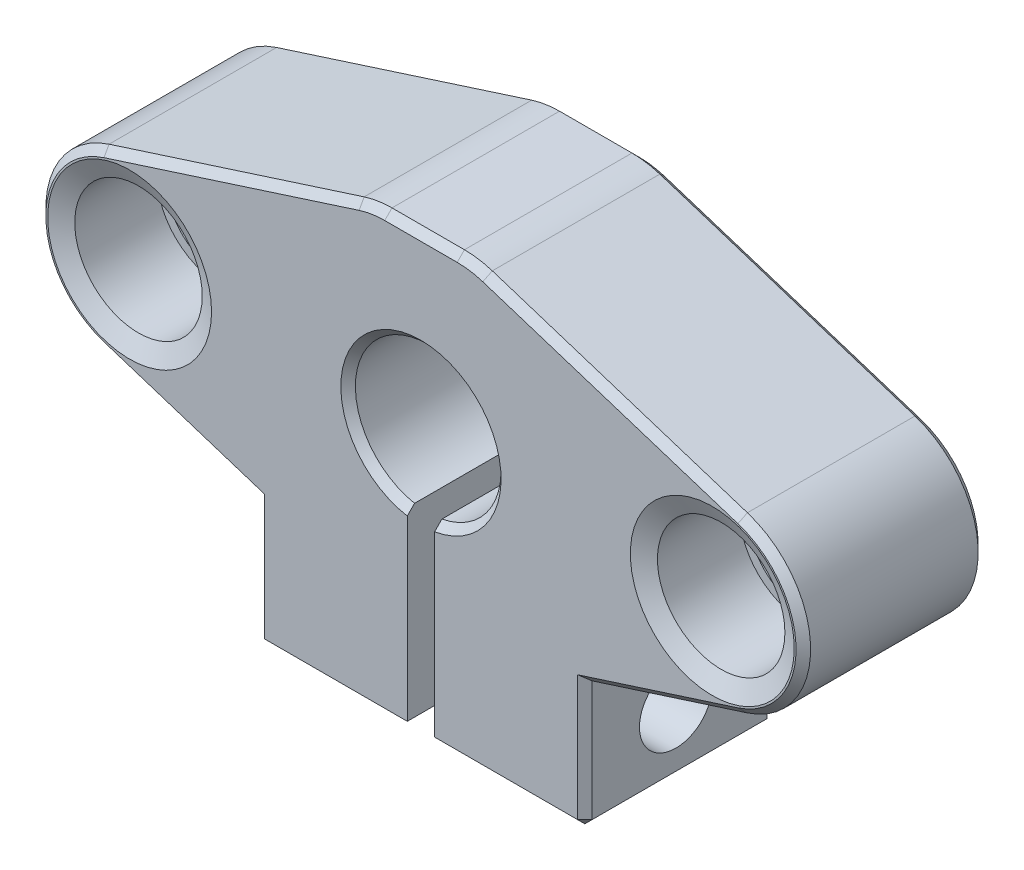
from build123d import *

# Parameters (mm, degrees)
BOSS_EXTRUDE1_DEPTH             = 10
CUT_EXTRUDE1_DEPTH              = 28.408940147
CUT_EXTRUDE2_DEPTH              = 28.408940147
SKETCH4_W                       = 4
SKETCH4_H                       = 10
SKETCH5_W                       = 2
SKETCH5_H                       = 20.25
F_4_0_4_DIAMETER_HOLE2_D        = 4
F_4_0_4_DIAMETER_HOLE2_DEPTH    = 20.25
M7X1_0_TAPPED_HOLE1_D           = 6
M7X1_0_TAPPED_HOLE1_CBORE_D     = 7
M7X1_0_TAPPED_HOLE1_CBORE_DEPTH = 5
FILLET1_R                       = 5
CHAMFER1_SIZE                   = 1
CHAMFER1_SIZE2                  = 0.487732589
CHAMFER2_SIZE                   = 0.4
CHAMFER3_SIZE                   = 1
CHAMFER3_SIZE2                  = 0.487732589


with BuildPart() as part:
    # Sketch1 → Boss-Extrude1 (new body)
    with BuildSketch(Plane.XY.offset(10)):
        with BuildLine():
            Line((-9, -7.5), (-9, -14.5))
            Line((-9, -14.5), (9, -14.5))
            Line((9, -14.5), (9, -7.5))
            Line((9, -7.5), (17.529062862, -4.760458672))
            ThreePointArc((17.529062862, -4.760458672), (21, 0), (17.529062862, 4.760458672))
            Line((17.529062862, 4.760458672), (2.773364341, 9.5))
            Line((2.773364341, 9.5), (-2.773364341, 9.5))
            Line((-2.773364341, 9.5), (-17.529062862, 4.760458672))
            ThreePointArc((-17.529062862, 4.760458672), (-21, 0), (-17.529062862, -4.760458672))
            Line((-17.529062862, -4.760458672), (-9, -7.5))
        make_face()
    extrude(amount=-BOSS_EXTRUDE1_DEPTH)

    # Sketch2 → Cut-Extrude1 (cut, through all)
    with BuildSketch(Plane(origin=(0, 0, 0), x_dir=(-1, 0, 0), z_dir=(0, 0, -1))):
        Polygon((9, -11.230940108), (9, -10.769059892), (8.6, -11), align=None)
    extrude(amount=-CUT_EXTRUDE1_DEPTH, mode=Mode.SUBTRACT)

    # Sketch3 → Cut-Extrude2 (cut, through all)
    with BuildSketch(Plane(origin=(0, 0, 0), x_dir=(-1, 0, 0), z_dir=(0, 0, -1))):
        with BuildLine():
            Line((0.75, -14.5), (0.75, -3.929058411))
            ThreePointArc((0.75, -3.929058411), (0, -4), (-0.75, -3.929058411))
            Line((-0.75, -3.929058411), (-0.75, -14.5))
            Line((-0.75, -14.5), (0.75, -14.5))
        make_face()
    extrude(amount=-CUT_EXTRUDE2_DEPTH, mode=Mode.SUBTRACT)

    # Sketch4 → Cut-Revolve1 (revolve, cut)
    with BuildSketch(Plane.XZ):
        with Locations((2, 5)):
            Rectangle(SKETCH4_W, SKETCH4_H)
    revolve(axis=Axis((0, 0, 10), (0, 0, -1)), mode=Mode.SUBTRACT)

    # Sketch5 → Ø4.0 (4) Diameter Hole1 (revolve, cut)
    with BuildSketch(Plane(origin=(-0.75, -11, 5), x_dir=(0, 0, -1), z_dir=(0, 1, 0))):
        with Locations((1, 10.125)):
            Rectangle(SKETCH5_W, SKETCH5_H)
    revolve(axis=Axis((5.6, -11, 5), (-1, 0, 0)), mode=Mode.SUBTRACT)

    # Ø4.0 (4) Diameter Hole2
    with Locations(Plane.ZY.offset(-0.75)):
        with Locations((5, -11)):
            Hole(F_4_0_4_DIAMETER_HOLE2_D / 2, depth=F_4_0_4_DIAMETER_HOLE2_DEPTH)

    # M7x1.0 Tapped Hole1 (through all)
    with Locations(Plane.XY.offset(10)):
        with Locations((-16, 0), (16, 0)):
            CounterBoreHole(M7X1_0_TAPPED_HOLE1_D / 2, M7X1_0_TAPPED_HOLE1_CBORE_D / 2, M7X1_0_TAPPED_HOLE1_CBORE_DEPTH)

    # Fillet1
    fillet1_edges = [part.edges().sort_by_distance(p)[0] for p in [
        (-2.773364341, 9.5, 5),
        (2.773364341, 9.5, 5),
    ]]
    fillet(fillet1_edges, radius=FILLET1_R)

    # Chamfer1
    chamfer1_edges = [part.edges().sort_by_distance(p)[0] for p in [
        (12.5, 0, 10),
        (-19.5, 0, 10),
    ]]
    chamfer1_side = [part.faces().sort_by_distance(p)[0] for p in [
        (0, 9.016264535, 10),
    ]]
    chamfer(chamfer1_edges, length=CHAMFER1_SIZE, length2=CHAMFER1_SIZE2, reference=chamfer1_side[0])

    # Chamfer2
    chamfer2_edges = [part.edges().sort_by_distance(p)[0] for p in [
        (13.264531431, -6.130229336, 0),
        (21, 0, 0),
        (10.524097746, 7.010458672, 0),
        (2.763925905, 9.439751682, 0),
        (0, 9.5, 0),
        (-2.763925905, 9.439751682, 0),
        (-10.524097746, 7.010458672, 0),
        (-13.264531431, -6.130229336, 0),
        (-21, 0, 0),
        (-9, -9.134529946, 10),
        (-13.264531431, -6.130229336, 10),
        (-21, 0, 10),
        (-10.524097746, 7.010458672, 10),
        (-2.763925905, 9.439751682, 10),
        (0, 9.5, 10),
        (2.763925905, 9.439751682, 10),
        (10.524097746, 7.010458672, 10),
        (21, 0, 10),
        (13.264531431, -6.130229336, 10),
        (9, -11, 10),
        (4.875, -14.5, 10),
        (9, -14.5, 5),
        (0.75, -14.5, 5),
        (4.875, -14.5, 0),
        (0, 4, 10),
        (-9, -12.865470054, 10),
        (-9, -14.5, 5),
        (-4.875, -14.5, 0),
        (-0.75, -14.5, 5),
        (-4.875, -14.5, 10),
        (0, 4, 0),
    ]]
    chamfer(chamfer2_edges, length=CHAMFER2_SIZE - 0.0001)  # a hair under: the kernel refuses the full size

    # Chamfer3
    chamfer3_edges = [part.edges().sort_by_distance(p)[0] for p in [
        (19, 0, 0),
        (-13, 0, 0),
    ]]
    chamfer3_side = [part.faces().sort_by_distance(p)[0] for p in [
        (4.875, -13.627267497, 0),
    ]]
    chamfer(chamfer3_edges, length=CHAMFER3_SIZE, length2=CHAMFER3_SIZE2, reference=chamfer3_side[0])


solid = part.part
